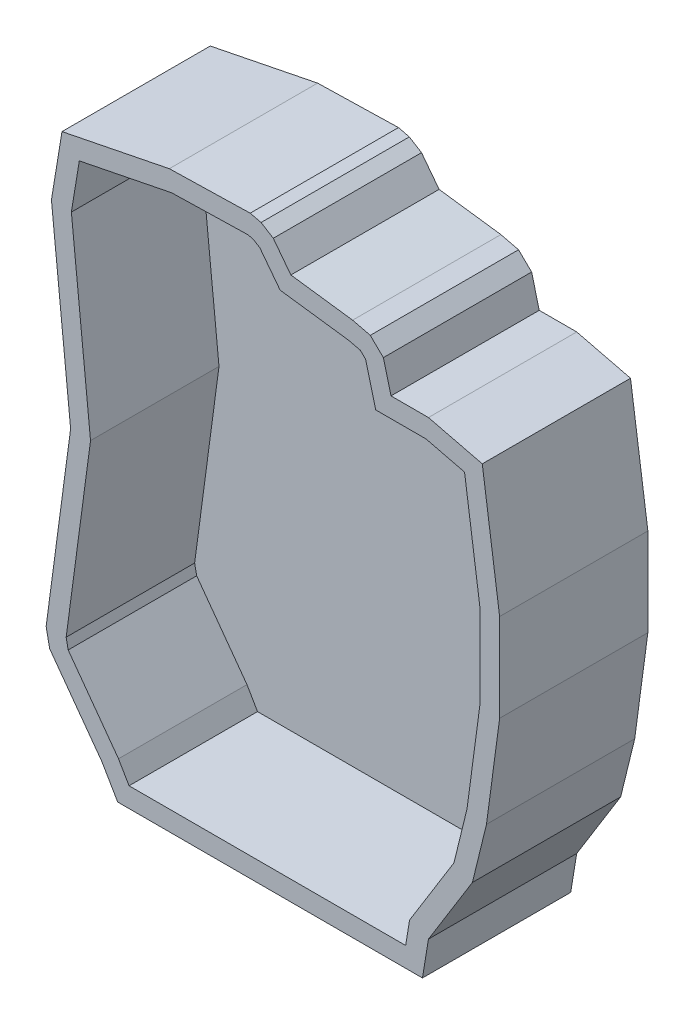
from build123d import *

# Parameters (mm, degrees)
BOSS_EXTRUDE1_DEPTH = 30
SHELL1_T            = -4


with BuildPart() as part:
    # Sketch1 → Boss-Extrude1 (new body)
    with BuildSketch(Plane.XY):
        Polygon((546.580924534, 9.896085679), (608.250924534, 9.896085679), (609.468725462, 17.325239217), (618.364062826, 31.698748766), (621.209508482, 43.308723045), (623.868380606, 63.224196603), (623.868380606, 81.054488799), (620.357339754, 106.059490311), (609.468725462, 108.728140515), (601.88762533, 108.728140515), (600.342350418, 114.668879106), (597.693307712, 117.244337292), (594.121848564, 118.119653006), (581.623216062, 119.788318601), (578.065152196, 124.442825109), (575.59297034, 125.972784898), (573.39799577, 126.510743097), (557.030037078, 126.118131563), (535.309704018, 121.76025213), (533.883150006, 113.057607434), (533.173455584, 108.728140515), (536.320171406, 77.786869686), (537.054893461, 70.562437811), (532.098682684, 33.439447285), (532.810591456, 29.891185826), (543.388975695, 15.373727724), align=None)
    extrude(amount=BOSS_EXTRUDE1_DEPTH)

    # Shell1
    shell1_openings = [part.faces().sort_by_distance(p)[0] for p in [
        (576.576443009, 66.455408546, 30),
    ]]
    offset(amount=SHELL1_T, openings=shell1_openings, kind=Kind.INTERSECTION)


solid = part.part
